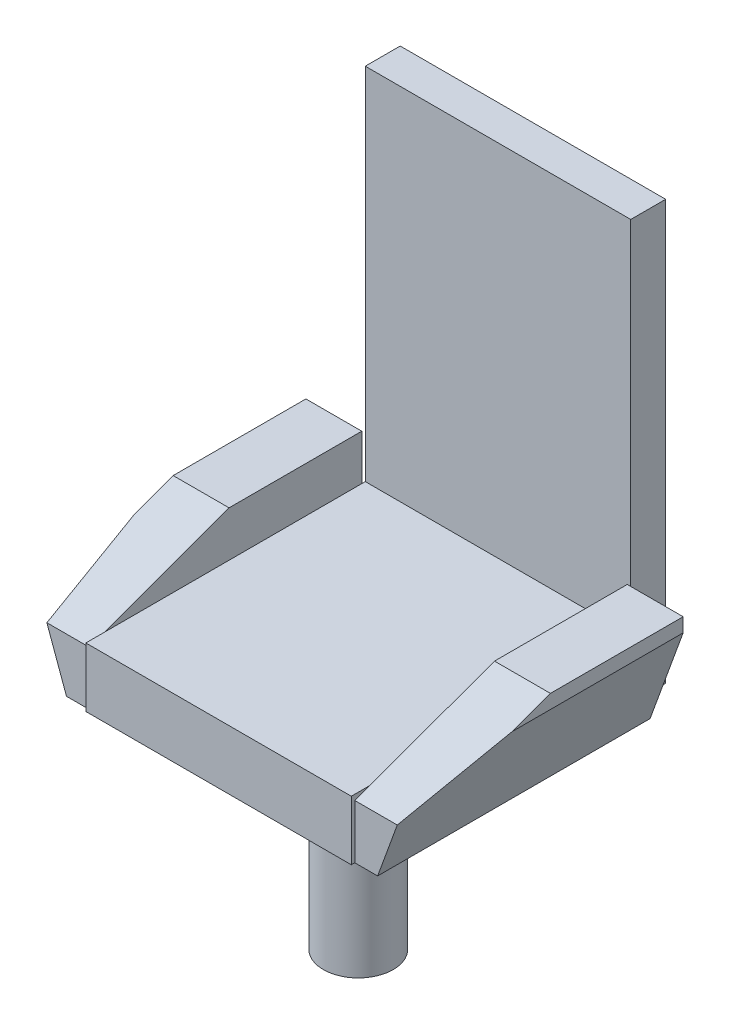
from build123d import *
from OCP.BRepFilletAPI import BRepFilletAPI_MakeChamfer

# Parameters (mm, degrees)
SKETCH1_W           = 380
SKETCH1_H           = 400
BOSS_EXTRUDE1_DEPTH = 85
SKETCH2_W           = 80
SKETCH2_H           = 390
BOSS_EXTRUDE2_DEPTH = 150
CHAMFER1_SIZE       = 72.794046853
CHAMFER1_SIZE_2     = 200
CHAMFER2_SIZE       = 130
CHAMFER2_SIZE2      = 47.316130455
SKETCH3_W           = 380
SKETCH3_H           = 600
BOSS_EXTRUDE3_DEPTH = 50
SKETCH4_R           = 50
BOSS_EXTRUDE4_DEPTH = 300


with BuildPart() as part:
    # Sketch1 → Boss-Extrude1 (new body)
    with BuildSketch(Plane(origin=(0, 0, 0), x_dir=(1, 0, 0), z_dir=(0, 1, 0))):
        Rectangle(SKETCH1_W, SKETCH1_H)
    extrude(amount=BOSS_EXTRUDE1_DEPTH)

    # Sketch2 → Boss-Extrude2 (add)
    with BuildSketch(Plane(origin=(0, 0, 0), x_dir=(1, 0, 0), z_dir=(0, 1, 0))):
        with Locations((-230, 0)):
            Rectangle(SKETCH2_W, SKETCH2_H)
        with Locations((230, 0)):
            Rectangle(SKETCH2_W, SKETCH2_H)
    extrude(amount=BOSS_EXTRUDE2_DEPTH)

    # Chamfer1
    # the kernel refuses this chamfer: 200, 72.794046853 mm, written as the material it takes off along each edge
    with BuildSketch(Plane(origin=(-788.83894651, 150, 195), x_dir=(0, -0.9950833631817488, 0.09904090225204945), z_dir=(1, 0, 0)), Plane(origin=(190, 150, 195), x_dir=(0, -0.9950833631817488, 0.09904090225204945), z_dir=(1, 0, 0))) as chamfer1_piece_1:
        Polygon((CHAMFER1_SIZE * 0.995083363185, CHAMFER1_SIZE * 0.0990409022524), (-CHAMFER1_SIZE_2 * 0.099040902252, CHAMFER1_SIZE_2 * 0.995083363182), (0, 0), align=None)
    extrude(amount=598.83894651, mode=Mode.SUBTRACT)
    with BuildSketch(Plane(origin=(-788.83894651, 150, 195), x_dir=(0, -0.9950833631817488, 0.09904090225204945), z_dir=(1, 0, 0))) as chamfer1_piece_2_section:
        Polygon((CHAMFER1_SIZE * 0.995083363185, CHAMFER1_SIZE * 0.0990409022524), (-CHAMFER1_SIZE_2 * 0.099040902252, CHAMFER1_SIZE_2 * 0.995083363182), (0, 0), align=None)
    chamfer1_piece_2 = extrude(amount=1117.67789302, mode=Mode.PRIVATE)
    chamfer1_piece_2 = split(chamfer1_piece_2, bisect_by=Plane(origin=(190, 82.401984382, 187.862010755), z_dir=(1, 0, 0)), keep=Keep.TOP, mode=Mode.PRIVATE)
    add(chamfer1_piece_2, mode=Mode.SUBTRACT)
    with BuildSketch(Plane(origin=(-328.83894651, 150, 195), x_dir=(0, -0.9950833631817488, 0.09904090225204945), z_dir=(1, 0, 0))) as chamfer1_piece_3_section:
        Polygon((CHAMFER1_SIZE * 0.995083363185, CHAMFER1_SIZE * 0.0990409022524), (-CHAMFER1_SIZE_2 * 0.099040902252, CHAMFER1_SIZE_2 * 0.995083363182), (0, 0), align=None)
    chamfer1_piece_3 = extrude(amount=1117.67789302, mode=Mode.PRIVATE)
    chamfer1_piece_3 = split(chamfer1_piece_3, bisect_by=Plane(origin=(-190, 82.401984382, 187.862010755), z_dir=(-1, 0, 0)), keep=Keep.TOP, mode=Mode.PRIVATE)
    add(chamfer1_piece_3, mode=Mode.SUBTRACT)

    # Chamfer2: one chamfer whose edges measure the first distance from different faces: ONE call of the kernel's chamfer builder (chamfer() names one face for all edges)
    chamfer2_edges_1 = [part.edges().sort_by_distance(p)[0] for p in [
        (270, 0, 0),
    ]]
    chamfer2_side_1 = [part.faces().sort_by_distance(p)[0] for p in [
        (270, 67.789562339, -18.238567166),
    ]]
    chamfer2_edges_2 = [part.edges().sort_by_distance(p)[0] for p in [
        (-270, 0, 0),
    ]]
    chamfer2_side_2 = [part.faces().sort_by_distance(p)[0] for p in [
        (-270, 67.789562339, -18.238567166),
    ]]
    chamfer2 = BRepFilletAPI_MakeChamfer(part.part.solid().wrapped)
    for e in chamfer2_edges_1:
        chamfer2.Add(CHAMFER2_SIZE, CHAMFER2_SIZE2, e.wrapped, chamfer2_side_1[0].wrapped)  # the first distance lies on this face
    for e in chamfer2_edges_2:
        chamfer2.Add(CHAMFER2_SIZE, CHAMFER2_SIZE2, e.wrapped, chamfer2_side_2[0].wrapped)  # the first distance lies on this face
    add(Compound.cast(chamfer2.Shape()), mode=Mode.REPLACE)

    # Sketch3 → Boss-Extrude3 (add)
    with BuildSketch(Plane(origin=(0, 0, -200), x_dir=(-1, 0, 0), z_dir=(0, 0, -1))):
        with Locations((0, 300)):
            Rectangle(SKETCH3_W, SKETCH3_H)
    extrude(amount=BOSS_EXTRUDE3_DEPTH)

    # Sketch4 → Boss-Extrude4 (add)
    with BuildSketch(Plane.XZ):
        with Locations(Location((0, 0, 0), (0, 0, 270))):
            Circle(SKETCH4_R)
    extrude(amount=BOSS_EXTRUDE4_DEPTH)


solid = part.part
